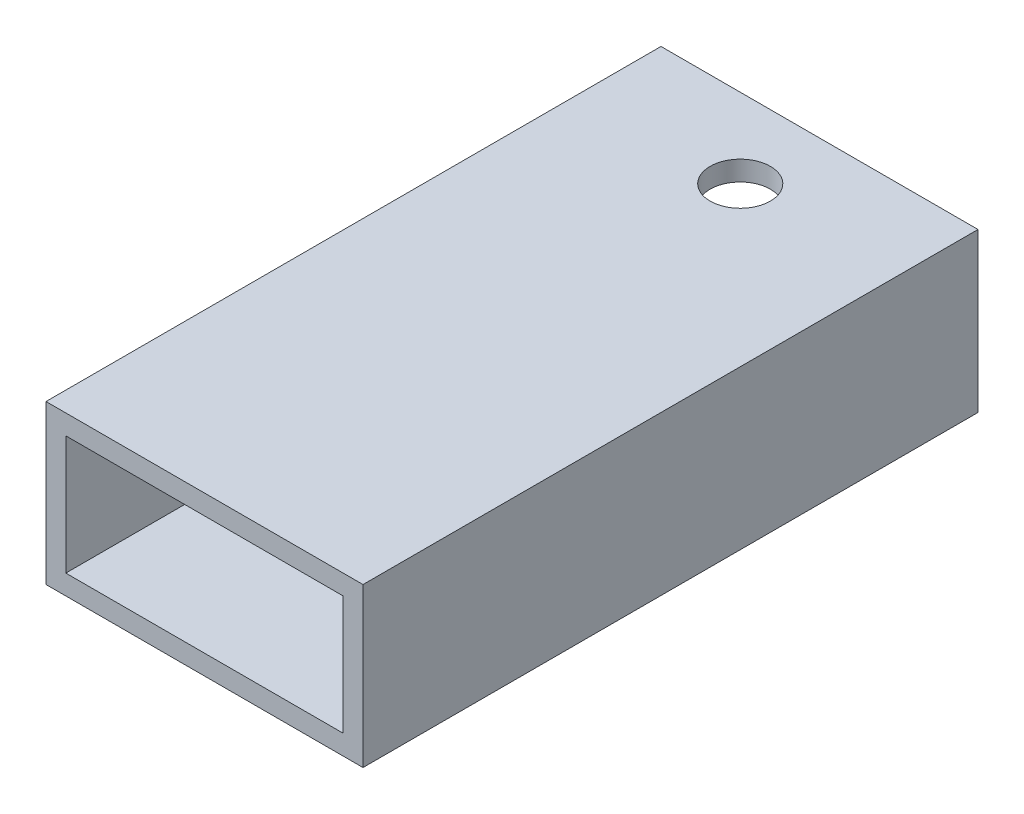
from build123d import *

# Parameters (mm, degrees)
SKETCH1_W           = 50.8
SKETCH1_H           = 25.4
SKETCH1_W_2         = 44.45
SKETCH1_H_2         = 19.05
BOSS_EXTRUDE1_DEPTH = 98.552
SKETCH2_R           = 4.826
CUT_EXTRUDE1_DEPTH  = 114.746633814


with BuildPart() as part:
    # Sketch1 → Boss-Extrude1 (new body)
    with BuildSketch(Plane.XY):
        with Locations((25.4, 12.7)):
            Rectangle(SKETCH1_W, SKETCH1_H)
        with Locations((25.4, 12.7)):
            Rectangle(SKETCH1_W_2, SKETCH1_H_2, mode=Mode.SUBTRACT)
    extrude(amount=BOSS_EXTRUDE1_DEPTH)

    # Sketch2 → Cut-Extrude1 (cut, through all)
    with BuildSketch(Plane.XZ):
        with Locations((25.4, 12.7)):
            Circle(SKETCH2_R)
    extrude(amount=-CUT_EXTRUDE1_DEPTH, mode=Mode.SUBTRACT)


solid = part.part
